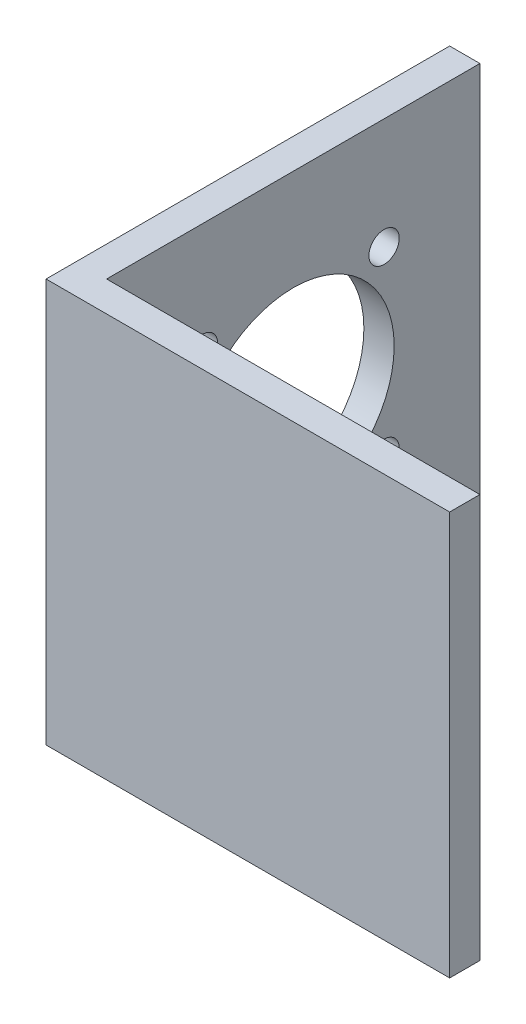
from build123d import *

# Parameters (mm, degrees)
EXTRUDE_1_DEPTH     = 40
SKETCH_2_R          = 10
SKETCH_2_R_2        = 1.5
CUT_EXTRUDE_1_DEPTH = 40


with BuildPart() as part:
    # Эскиз1 → Бобышка-Вытянуть1 (new body)
    with BuildSketch(Plane(origin=(0, 0, 0), x_dir=(1, 0, 0), z_dir=(0, 1, 0))):
        Polygon((0, 0), (40, 0), (40, 3), (3, 3), (3, 40), (0, 40), align=None)
    extrude(amount=EXTRUDE_1_DEPTH)

    # Эскиз2 → Вырез-Вытянуть1 (cut)
    with BuildSketch(Plane(origin=(3, 0, 0), x_dir=(0, 0, -1), z_dir=(1, 0, 0))):
        with Locations((21.5, 20)):
            Circle(SKETCH_2_R)
        with Locations((30.5, 29)):
            Circle(SKETCH_2_R_2)
        with Locations((30.5, 11)):
            Circle(SKETCH_2_R_2)
        with Locations((12.5, 11)):
            Circle(SKETCH_2_R_2)
        with Locations((12.5, 29)):
            Circle(SKETCH_2_R_2)
    extrude(amount=-CUT_EXTRUDE_1_DEPTH, mode=Mode.SUBTRACT)


solid = part.part
